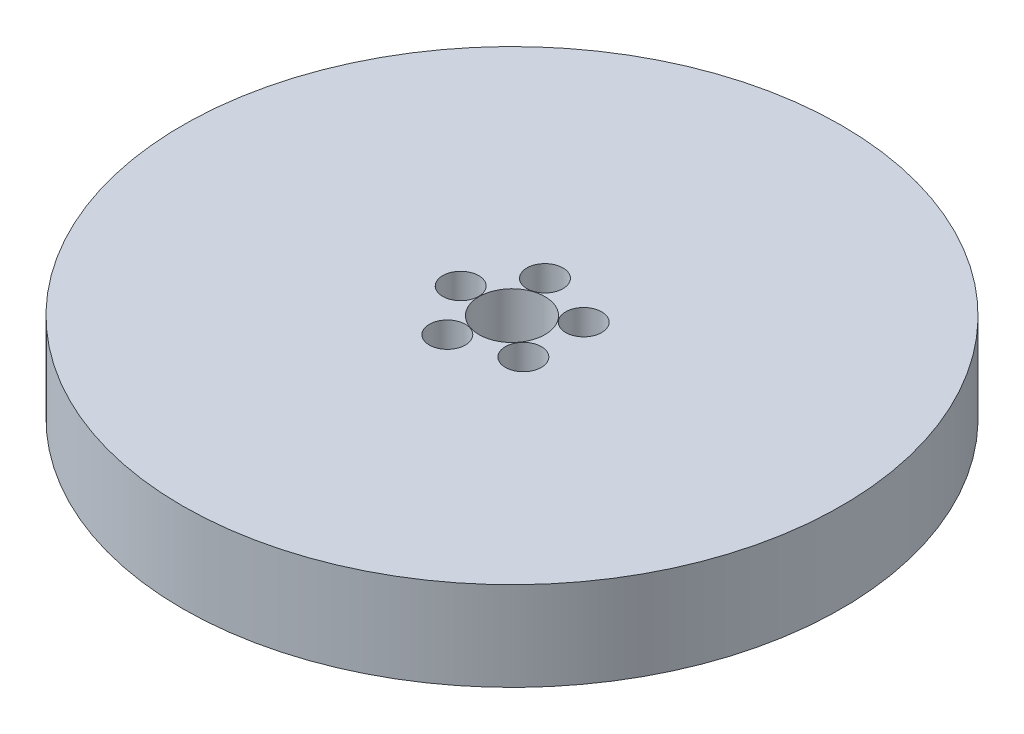
from build123d import *

# Parameters (mm, degrees)
SKETCH1_R           = 100
BOSS_EXTRUDE1_DEPTH = 27
SKETCH2_R           = 10
CUT_EXTRUDE1_DEPTH  = 144.975692393
SKETCH3_R           = 5.466244997
CUT_EXTRUDE2_DEPTH  = 23.480402933
CIRPATTERN1_COUNT   = 5


with BuildPart() as part:
    # Sketch1 → Boss-Extrude1 (new body)
    with BuildSketch(Plane(origin=(0, 0, 0), x_dir=(1, 0, 0), z_dir=(0, 1, 0))):
        Circle(SKETCH1_R)
    extrude(amount=BOSS_EXTRUDE1_DEPTH)

    # Sketch2 → Cut-Extrude1 (cut, through all)
    with BuildSketch(Plane(origin=(0, 0, 0), x_dir=(1, 0, 0), z_dir=(0, 1, 0))):
        Circle(SKETCH2_R)
    extrude(amount=CUT_EXTRUDE1_DEPTH, mode=Mode.SUBTRACT)

    # Sketch3 → Cut-Extrude2 (cut)
    with BuildSketch(Plane(origin=(0, 27, 0), x_dir=(1, 0, 0), z_dir=(0, 1, 0))):
        with Locations((-15.573840521, 0)):
            Circle(SKETCH3_R)
    cut_extrude2 = extrude(amount=-CUT_EXTRUDE2_DEPTH, mode=Mode.SUBTRACT)

    # CirPattern1: Cut-Extrude2 ×5 about axis
    cirpattern1_axis = Axis((0, 0, 0), (0, 1, 0))
    for i in range(1, CIRPATTERN1_COUNT):
        add(cut_extrude2.rotate(cirpattern1_axis, i * 360 / CIRPATTERN1_COUNT), mode=Mode.SUBTRACT)


solid = part.part
